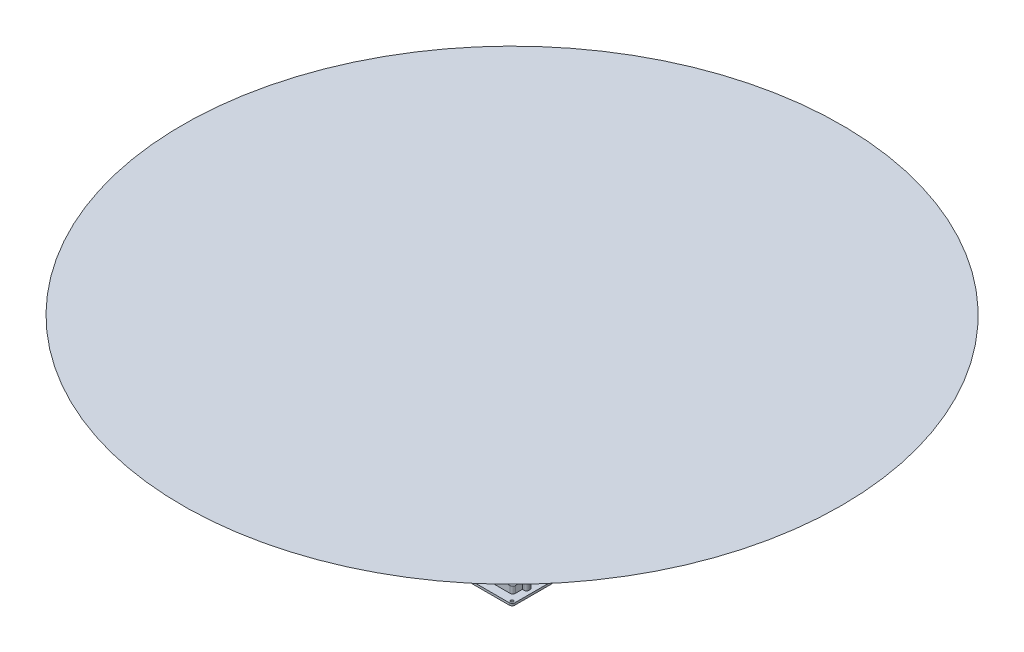
from build123d import *

# Parameters (mm, degrees)
SKETCH1_W           = 32
SKETCH1_H           = 32
SKETCH1_R           = 1.04775
BOSS_EXTRUDE1_DEPTH = 1.6002
BOSS_EXTRUDE2_DEPTH = 5.1308
FILLET1_R           = 2.1
FILLET2_R           = 1.905
SKETCH3_R           = 7.5946
BOSS_EXTRUDE3_DEPTH = 16.129


# Read off the part's stored shape, not the designer's step: Extrude-Thin2
with BuildPart() as part:
    # Sketch1 → Boss-Extrude1 (new body)
    with BuildSketch(Plane(origin=(0, 0, 0), x_dir=(1, 0, 0), z_dir=(0, 1, 0))):
        Rectangle(SKETCH1_W, SKETCH1_H)
        with Locations(Location((13.7500106, 13.7500106, 0), (0, 0, 270))):
            Circle(SKETCH1_R, mode=Mode.SUBTRACT)
        with Locations(Location((-13.7500106, 13.7500106, 0), (0, 0, 270))):
            Circle(SKETCH1_R, mode=Mode.SUBTRACT)
        with Locations(Location((-13.75, -13.7500106, 0), (0, 0, 270))):
            Circle(SKETCH1_R, mode=Mode.SUBTRACT)
        with Locations(Location((13.7500106, -13.7500106, 0), (0, 0, 270))):
            Circle(SKETCH1_R, mode=Mode.SUBTRACT)
    extrude(amount=BOSS_EXTRUDE1_DEPTH)

    # Sketch2 → Boss-Extrude2 (add)
    with BuildSketch(Plane(origin=(0, 1.6002, 0), x_dir=(1, 0, 0), z_dir=(0, 1, 0))):
        Polygon((-10.033, 9.525), (10.033, 9.525), (10.033, 2.2733), (13.2334, 2.2733), (13.2334, -2.2733), (10.033, -2.2733), (10.033, -9.525), (-10.033, -9.525), (-10.033, -2.2733), (-13.2334, -2.2733), (-13.2334, 2.2733), (-10.033, 2.2733), align=None)
    extrude(amount=BOSS_EXTRUDE2_DEPTH)

    # Fillet1
    fillet1_edges = [part.edges().sort_by_distance(p)[0] for p in [
        (-16, 0.8001, -16),
        (16, 0.8001, -16),
        (16, 0.8001, 16),
        (-16, 0.8001, 16),
    ]]
    fillet(fillet1_edges, radius=FILLET1_R)

    # Fillet2
    fillet2_edges = [part.edges().sort_by_distance(p)[0] for p in [
        (-10.033, 4.1656, -9.525),
        (-13.2334, 4.1656, -2.2733),
        (-13.2334, 4.1656, 2.2733),
        (-10.033, 4.1656, 9.525),
        (10.033, 4.1656, 9.525),
        (13.2334, 4.1656, 2.2733),
        (13.2334, 4.1656, -2.2733),
        (10.033, 4.1656, -9.525),
    ]]
    fillet(fillet2_edges, radius=FILLET2_R)

    # Sketch3 → Boss-Extrude3 (add)
    with BuildSketch(Plane(origin=(0, 6.731, 0), x_dir=(1, 0, 0), z_dir=(0, 1, 0))):
        with Locations(Location((0, 0, 0), (0, 0, 90))):
            Circle(SKETCH3_R)
    extrude(amount=BOSS_EXTRUDE3_DEPTH)

    # Extrude-Thin2 outline → Extrude-Thin2 (revolve)
    with BuildSketch(Plane.XY):
        Polygon((0, 175.26), (0, 24.764601785), (3.048, 22.86), (3.175, 22.86), (4.3815, 23.613904873), (5.588, 22.86), (5.715, 22.86), (249.605982226, 175.26), align=None)
    revolve(axis=Axis((0, 0, 0), (0, 1, 0)))


solid = part.part
